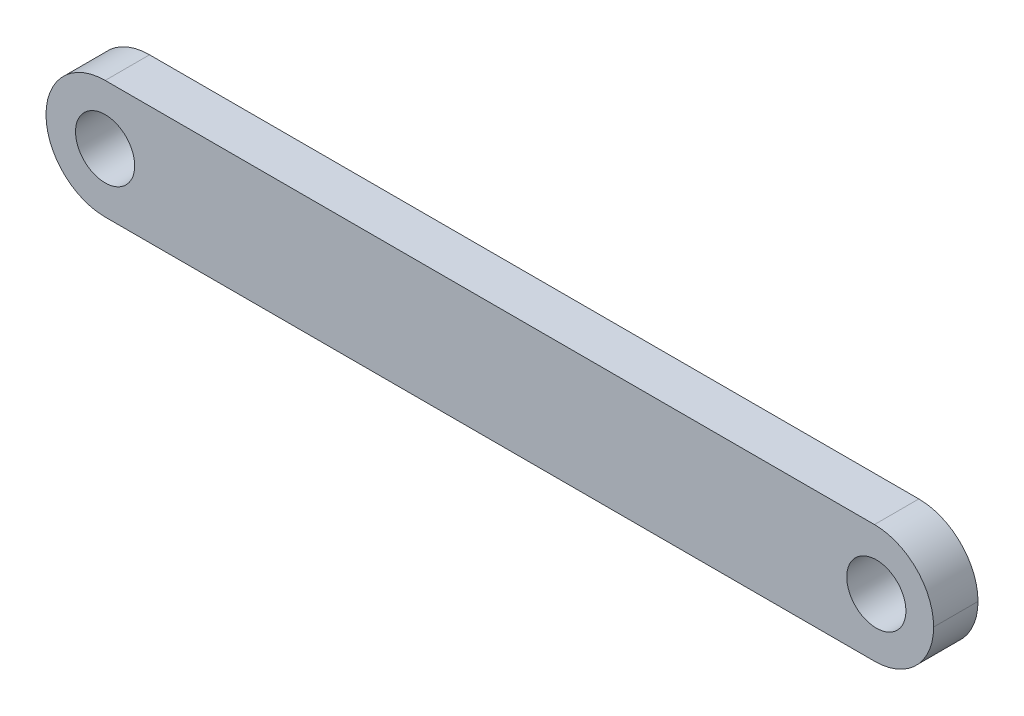
from build123d import *

# Parameters (mm, degrees)
SKETCH_1_W      = 60
SKETCH_1_H      = 8
SKETCH_1_R      = 2
EXTRUDE_1_DEPTH = 3
FILLET_2_R      = 4


with BuildPart() as part:
    # 草图1 → 凸台-拉伸1 (new body)
    with BuildSketch(Plane.XY):
        Rectangle(SKETCH_1_W, SKETCH_1_H)
        with Locations((-26.005104264, 0)):
            Circle(SKETCH_1_R, mode=Mode.SUBTRACT)
        with Locations((26.127679476, 0)):
            Circle(SKETCH_1_R, mode=Mode.SUBTRACT)
    extrude(amount=EXTRUDE_1_DEPTH)

    # 圆角2
    fillet_2_edges = [part.edges().sort_by_distance(p)[0] for p in [
        (30, -4, 1.5),
        (30, 4, 1.5),
        (-30, -4, 1.5),
        (-30, 4, 1.5),
    ]]
    fillet(fillet_2_edges, radius=FILLET_2_R - 0.0001)  # a hair under: the kernel refuses the full size


solid = part.part
